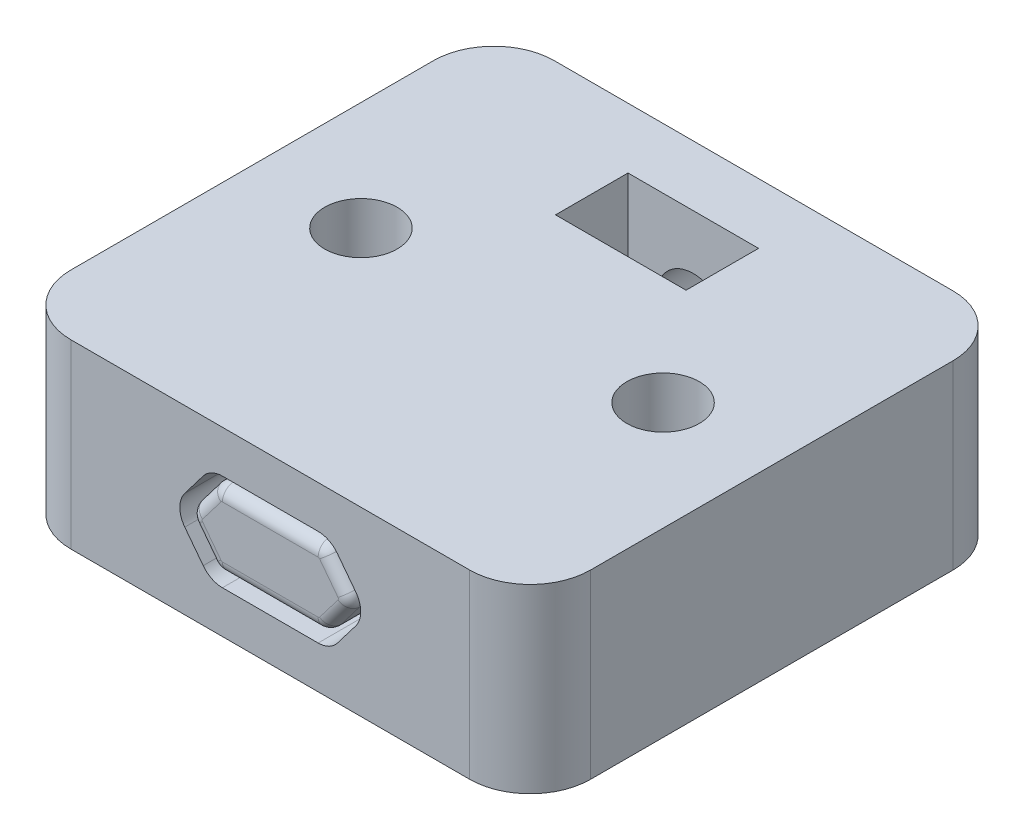
from build123d import *

# Parameters (mm, degrees)
SKETCH1_W           = 43
SKETCH1_H           = 40
BOSS_EXTRUDE1_DEPTH = 15
CUT_EXTRUDE1_DEPTH  = 25
SKETCH3_R           = 3
CUT_EXTRUDE2_DEPTH  = 61.613529843
SKETCH4_R           = 3
CUT_EXTRUDE3_DEPTH  = 61.613529843
FILLET1_R           = 2
FILLET3_R           = 5
SURFACE_KNIT1_START = -25
SURFACE_KNIT1_DEPTH = 25
FILLET2_R           = 1
CUT_EXTRUDE4_START  = 5
CUT_EXTRUDE4_DEPTH  = 6


# Read off the part's stored shape, not the designer's step: Surface-Knit1
with BuildPart() as part:
    # Sketch1 → Boss-Extrude1 (new body)
    with BuildSketch(Plane(origin=(0, 0, 0), x_dir=(1, 0, 0), z_dir=(0, 1, 0))):
        with Locations((21.5, 20)):
            Rectangle(SKETCH1_W, SKETCH1_H)
    extrude(amount=BOSS_EXTRUDE1_DEPTH)

    # Sketch2 → Cut-Extrude1 (cut)
    with BuildSketch(Plane.XY):
        Polygon((13.5, 7.5), (16.55, 11.5), (26.45, 11.5), (29.5, 7.5), (26.45, 3.5), (16.55, 3.5), align=None)
    extrude(amount=-CUT_EXTRUDE1_DEPTH, mode=Mode.SUBTRACT)

    # Sketch3 → Cut-Extrude2 (cut, through all)
    with BuildSketch(Plane.XY):
        with Locations((21.5, 7.5)):
            Circle(SKETCH3_R)
    extrude(amount=-CUT_EXTRUDE2_DEPTH, mode=Mode.SUBTRACT)

    # Sketch4 → Cut-Extrude3 (cut, through all)
    with BuildSketch(Plane(origin=(0, 0, 0), x_dir=(1, 0, 0), z_dir=(0, 1, 0))):
        with Locations(Location((9, 20, 0), (0, 0, 270))):
            Circle(SKETCH4_R)
        with Locations(Location((34, 20, 0), (0, 0, 270))):
            Circle(SKETCH4_R)
    extrude(amount=CUT_EXTRUDE3_DEPTH, mode=Mode.SUBTRACT)

    # Fillet1
    fillet1_edges = [part.edges().sort_by_distance(p)[0] for p in [
        (16.55, 3.5, -12.5),
        (13.5, 7.5, -12.5),
        (16.55, 11.5, -12.5),
        (26.45, 11.5, -12.5),
        (29.5, 7.5, -12.5),
        (26.45, 3.5, -12.5),
    ]]
    fillet(fillet1_edges, radius=FILLET1_R)

    # Fillet3
    fillet3_edges = [part.edges().sort_by_distance(p)[0] for p in [
        (0, 7.5, -40),
        (43, 7.5, -40),
        (43, 7.5, 0),
        (0, 7.5, 0),
    ]]
    fillet(fillet3_edges, radius=FILLET3_R)

    # Sketch6 → Cut-Extrude4 (cut)
    with BuildSketch(Plane.XY.offset(-40).offset(CUT_EXTRUDE4_START)):
        Polygon((26.9, 10.617691454), (26.9, 15), (16.1, 15), (16.1, 10.617691454), (16.1, 4.382308546), (21.5, 1.264617093), (26.9, 4.382308546), align=None)
    extrude(amount=CUT_EXTRUDE4_DEPTH, mode=Mode.SUBTRACT)


with BuildPart() as body_2:
    # Surface-Knit1 outline → Surface-Knit1 (new body)
    with BuildSketch(Plane.XY.offset(SURFACE_KNIT1_START)):
        with BuildLine():
            ThreePointArc((16.625595514, 4.802705944), (17.029877681, 4.469371996), (17.540079522, 4.35))
            Line((17.540079522, 4.35), (25.459920478, 4.35))
            ThreePointArc((25.459920478, 4.35), (25.970122319, 4.469371996), (26.374404486, 4.802705944))
            Line((26.374404486, 4.802705944), (27.899404486, 6.802705944))
            ThreePointArc((27.899404486, 6.802705944), (28.134920478, 7.5), (27.899404486, 8.197294056))
            Line((27.899404486, 8.197294056), (26.374404486, 10.197294056))
            ThreePointArc((26.374404486, 10.197294056), (25.970122319, 10.530628004), (25.459920478, 10.65))
            Line((25.459920478, 10.65), (17.540079522, 10.65))
            ThreePointArc((17.540079522, 10.65), (17.029877681, 10.530628004), (16.625595514, 10.197294056))
            Line((16.625595514, 10.197294056), (15.100595514, 8.197294056))
            ThreePointArc((15.100595514, 8.197294056), (14.865079522, 7.5), (15.100595514, 6.802705944))
            Line((15.100595514, 6.802705944), (16.625595514, 4.802705944))
        make_face()
    extrude(amount=SURFACE_KNIT1_DEPTH)

    # Fillet2
    fillet2_edges = [body_2.edges().sort_by_distance(p)[0] for p in [
        (14.865079522, 7.5, 0),
        (15.863095514, 9.197294056, -25),
        (15.863095514, 9.197294056, 0),
        (21.5, 10.65, -25),
        (21.5, 10.65, 0),
        (17.029877681, 10.530628004, -25),
        (17.029877681, 10.530628004, 0),
        (25.970122319, 10.530628004, -25),
        (25.970122319, 10.530628004, 0),
        (27.136904486, 9.197294056, -25),
        (27.136904486, 9.197294056, 0),
        (28.134920478, 7.5, -25),
        (28.134920478, 7.5, 0),
        (25.970122319, 4.469371996, -25),
        (25.970122319, 4.469371996, 0),
        (27.136904486, 5.802705944, -25),
        (27.136904486, 5.802705944, 0),
        (21.5, 4.35, -25),
        (21.5, 4.35, 0),
        (17.029877681, 4.469371996, -25),
        (17.029877681, 4.469371996, 0),
        (15.863095514, 5.802705944, 0),
        (15.863095514, 5.802705944, -25),
        (14.865079522, 7.5, -25),
    ]]
    fillet(fillet2_edges, radius=FILLET2_R)


solid = Compound([part.part, body_2.part])
